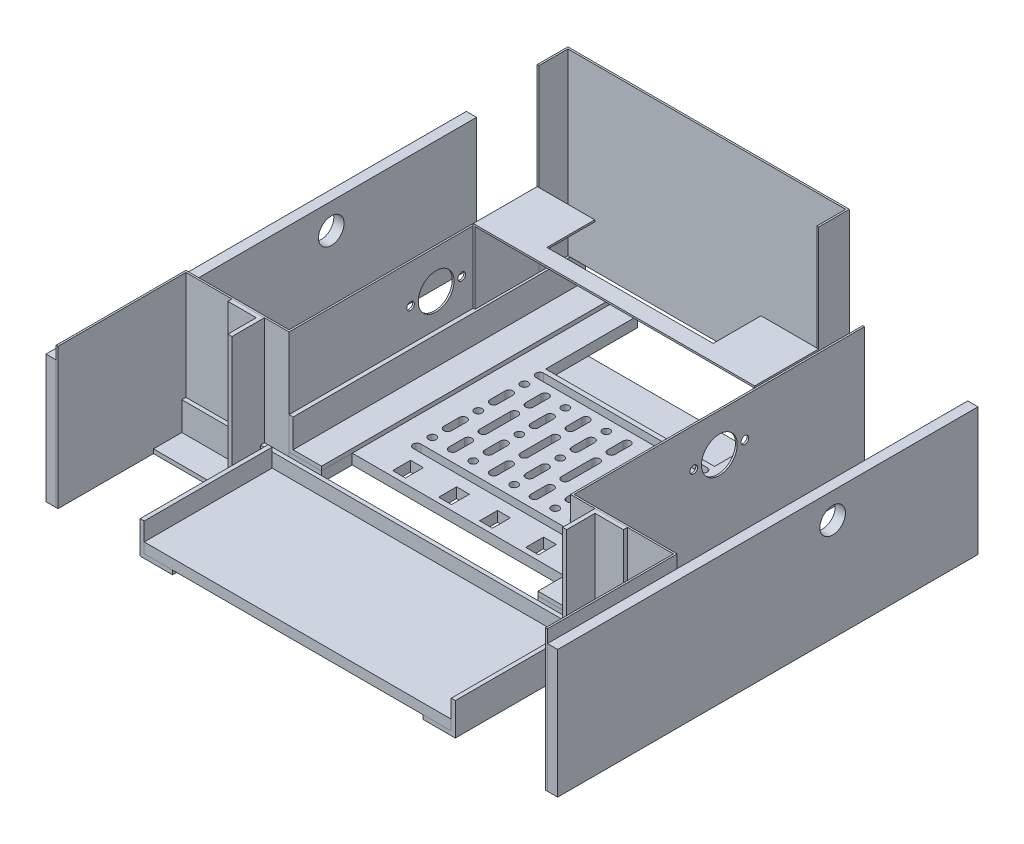
from build123d import *

# Parameters (mm, degrees)
PLATFORM_START                      = 18
SKETCH2_5_W                         = 120
SKETCH2_5_H                         = 50
PLATFORM_DEPTH                      = 4
STEEL_START                         = 10.8
STEEL_FRAME_RH_DEPTH                = 55
MDF_START                           = 10.8
SKETCH2_3_W                         = 4
SKETCH2_3_H                         = 164.3
MDF_WHEEL_COVER_RH_DEPTH            = 50
ALU_ANGLE_PLATFORM_REST_DEPTH       = 95.3
SHAFT_START                         = -55.7
DRIVE_AXLE_HOLES_R                  = 7
SHAFT_COUPLER_HOLES_DEPTH           = 111.4
BUSHING_START                       = -100
BUSHING_HOLES_OUTLINE_R             = 5
BUSHING_HOLES_DEPTH                 = 200
SKETCH7_W                           = 1.5
SKETCH7_H                           = 0.701
F_3_0MM_MOTOR_MOUNT_RH_AT_2_COUNT   = 2
F_3_0MM_MOTOR_MOUNT_RH_AT_2_PITCH   = 20
PLATFORM_START_2                    = -50
PLATFORM_ANGLE_RH_DEPTH             = 50
PLATFORM_START_3                    = 55
PLATFORM_ANGLE_RH_2_OUTLINE_R       = 1.5
PLATFORM_ANGLE_RH_2_DEPTH           = 0.7
MOTOR_START                         = -10.7
MOTOR_REST_CHASSIS_BRACING_LH_DEPTH = 114.3
CHASSIS_START                       = -125
SKETCH13_W                          = 110
SKETCH13_H                          = 4
CHASSIS_BASE_DEPTH                  = 114.3
SKETCH15_W                          = 84.6
SKETCH15_H                          = 12
SENSOR_CAVITY_DEPTH                 = 4
SKETCH14_W                          = 5
SKETCH14_H                          = 7
LINE_SENSOR_CAVITIES_DEPTH          = 4
SKETCH17_R                          = 1.5
WIRING_HOLES_DEPTH                  = 4
SKETCH19_W                          = 66
SKETCH19_H                          = 36
BATTERY_CAVITY_DEPTH                = 4
FLICKER_START                       = 23.5
FLICKER_MOUNT_RH_DEPTH              = 42.3
FLICKER_START_2                     = 12.4
FLICKER_MOUNT_RH_2_OUTLINE_W        = 1.6
FLICKER_MOUNT_RH_2_OUTLINE_H        = 11.1
FLICKER_MOUNT_RH_2_DEPTH            = 11.1
BATTERY_START                       = -105.7
BATTERY_SLOT_ANGLE_OUTLINE_W        = 110
BATTERY_SLOT_ANGLE_OUTLINE_H        = 1.6
BATTERY_SLOT_ANGLE_DEPTH            = 12.7
BATTERY_START_2                     = -94.6
BATTERY_SLOT_ANGLE_2_OUTLINE_W      = 110
BATTERY_SLOT_ANGLE_2_OUTLINE_H      = 11.1
BATTERY_SLOT_ANGLE_2_DEPTH          = 1.6
BATTERY_START_3                     = -55
BATTERY_HOLDER_OUTLINE_W            = 70
BATTERY_HOLDER_OUTLINE_H            = 0.7
BATTERY_HOLDER_DEPTH                = 110
BATTERY_HOLDER_2_OUTLINE_W          = 70
BATTERY_HOLDER_2_OUTLINE_H          = 11.3
BATTERY_HOLDER_2_DEPTH              = 0.7
BATTERY_START_4                     = 54.3
BATTERY_HOLDER_3_OUTLINE_W          = 70
BATTERY_HOLDER_3_OUTLINE_H          = 11.3
BATTERY_HOLDER_3_DEPTH              = 0.7
BOSS_EXTRUDE3_START                 = -107.7
BOSS_EXTRUDE3_OUTLINE_W             = 22.5
BOSS_EXTRUDE3_OUTLINE_H             = 0.7
BOSS_EXTRUDE3_DEPTH                 = 25
BOSS_EXTRUDE3_START_2               = -89
BOSS_EXTRUDE3_2_OUTLINE_W           = 65
BOSS_EXTRUDE3_2_OUTLINE_H           = 0.7
BOSS_EXTRUDE3_2_DEPTH               = 6.3
SKETCH24_W                          = 0.7
SKETCH24_H                          = 25
BOSS_EXTRUDE5_DEPTH                 = 28.7
BOSS_EXTRUDE5_2_DEPTH               = 28.7


# Read off the part's stored shape, not the designer's step: Bushing Holes, Platform Angle RH, Flicker Mount RH, Battery Slot Angle, Battery Holder, Boss-Extrude3
with BuildPart() as part:
    # Sketch2<5> → Platform (new body)
    with BuildSketch(Plane(origin=(0, 0, 0), x_dir=(1, 0, 0), z_dir=(0, 1, 0)).offset(PLATFORM_START)):
        with Locations((0, -15.9)):
            Rectangle(SKETCH2_5_W, SKETCH2_5_H)
    extrude(amount=-PLATFORM_DEPTH)


with BuildPart() as body_2:
    # Sketch2 → Steel Frame RH (new body)
    with BuildSketch(Plane(origin=(0, 0, 0), x_dir=(1, 0, 0), z_dir=(0, 1, 0)).offset(STEEL_START)):
        Polygon((-55, 125), (-55.7, 125), (-55.7, 11.4), (-96, 11.4), (-96, -39.3), (-95.3, -39.3), (-95.3, 10.7), (-55, 10.7), (-55, 55.2), (-55, 81.2), align=None)
    extrude(amount=STEEL_FRAME_RH_DEPTH)


with BuildPart() as body_3:
    # Steel Frame LH: mirrored copy
    add(body_2.part.mirror(Plane(origin=(0, 0, 0), x_dir=(0, 0, 1), z_dir=(1, 0, 0))))


with BuildPart() as body_4:
    # Sketch2<3> → MDF Wheel Cover RH (new body)
    with BuildSketch(Plane(origin=(0, 0, 0), x_dir=(1, 0, 0), z_dir=(0, 1, 0)).offset(MDF_START)):
        with Locations((-98, 42.85)):
            Rectangle(SKETCH2_3_W, SKETCH2_3_H)
    extrude(amount=MDF_WHEEL_COVER_RH_DEPTH)


with BuildPart() as body_5:
    # MDF Wheel Cover LH: mirrored copy
    add(body_4.part.mirror(Plane(origin=(0, 0, 0), x_dir=(0, 0, 1), z_dir=(1, 0, 0))))


with BuildPart() as body_6:
    # Sketch3 → Alu Angle Platform Rest (new, symmetric)
    with BuildSketch(Plane(origin=(0, 0, 0), x_dir=(0, 0, -1), z_dir=(1, 0, 0))):
        Polygon((9.1, 23.5), (9.1, 12.4), (-2, 12.4), (-2, 10.8), (10.7, 10.8), (10.7, 23.5), align=None)
    extrude(amount=ALU_ANGLE_PLATFORM_REST_DEPTH, both=True)


with BuildPart() as shaft_coupler_holes_tool:
    # Drive Axle Holes → Shaft Coupler Holes (new body)
    with BuildSketch(Plane(origin=(0, 0, 0), x_dir=(0, 0, -1), z_dir=(1, 0, 0)).offset(SHAFT_START)):
        with Locations(Location((68.2, 50.8, 0), (0, 0, 180))):
            Circle(DRIVE_AXLE_HOLES_R)
    extrude(amount=SHAFT_COUPLER_HOLES_DEPTH)


with BuildPart() as body_2_1:
    add(body_2.part)

    # Shaft Coupler Holes: cut by shaft_coupler_holes_tool
    add(shaft_coupler_holes_tool.part, mode=Mode.SUBTRACT)

    # Sketch7 → Ø3.0mm Motor Mount RH (revolve, cut)
    with BuildSketch(Plane(origin=(-55, 50.8, -78.2), x_dir=(0, 0, -1), z_dir=(0, 1, 0))):
        with Locations((0.75, 0.3505)):
            Rectangle(SKETCH7_W, SKETCH7_H)
    f_3_0mm_motor_mount_rh = revolve(axis=Axis((-48.65, 50.8, -78.2), (-1, 0, 0)), mode=Mode.SUBTRACT)

    # Ø3.0mm Motor Mount RH at 2: Ø3.0mm Motor Mount RH ×2
    with Locations(*[(0, 0, i * F_3_0MM_MOTOR_MOUNT_RH_AT_2_PITCH) for i in range(1, F_3_0MM_MOTOR_MOUNT_RH_AT_2_COUNT)]):
        add(f_3_0mm_motor_mount_rh, mode=Mode.SUBTRACT)


with BuildPart() as body_3_1:
    add(body_3.part)

    # Shaft Coupler Holes: cut by shaft_coupler_holes_tool
    add(shaft_coupler_holes_tool.part, mode=Mode.SUBTRACT)

    # Platform Angle RH 2 outline → Platform Angle RH 2 (cut)
    with BuildSketch(Plane.YZ.offset(PLATFORM_START_3)):
        with Locations((50.8, -78.2)):
            Circle(PLATFORM_ANGLE_RH_2_OUTLINE_R)
        with Locations((50.8, -58.2)):
            Circle(PLATFORM_ANGLE_RH_2_OUTLINE_R)
    extrude(amount=PLATFORM_ANGLE_RH_2_DEPTH, mode=Mode.SUBTRACT)


with BuildPart() as bushing_holes_tool:
    # Bushing Holes outline → Bushing Holes (new body)
    with BuildSketch(Plane.YZ.offset(BUSHING_START)):
        with Locations((50.8, -68.2)):
            Circle(BUSHING_HOLES_OUTLINE_R)
    extrude(amount=BUSHING_HOLES_DEPTH)


with BuildPart() as body_4_1:
    add(body_4.part)

    # Bushing Holes: cut by bushing_holes_tool
    add(bushing_holes_tool.part, mode=Mode.SUBTRACT)


with BuildPart() as body_5_1:
    add(body_5.part)

    # Bushing Holes: cut by bushing_holes_tool
    add(bushing_holes_tool.part, mode=Mode.SUBTRACT)


with BuildPart() as body_7:
    # Platform Angle RH outline → Platform Angle RH (new body)
    with BuildSketch(Plane.XY.offset(40.9).offset(PLATFORM_START_2)):
        Polygon((-48.9, 12.4), (-48.9, 14), (-60, 14), (-60, 25.1), (-61.6, 25.1), (-61.6, 12.4), align=None)
    extrude(amount=PLATFORM_ANGLE_RH_DEPTH)


with BuildPart() as body_8:
    # Platform Angle LH: mirrored copy
    add(body_7.part.mirror(Plane(origin=(0, 0, 0), x_dir=(0, 0, 1), z_dir=(1, 0, 0))))


with BuildPart() as body_9:
    # Sketch12 → Motor Rest + Chassis Bracing LH (new body)
    with BuildSketch(Plane.XY.offset(MOTOR_START)):
        Polygon((53.4, 26.7), (53.4, 37.8), (55, 37.8), (55, 25.1), (42.3, 25.1), (42.3, 26.7), align=None)
    extrude(amount=-MOTOR_REST_CHASSIS_BRACING_LH_DEPTH)


with BuildPart() as body_10:
    # Motor Rest + Chassis Bracing RH: mirrored copy
    add(body_9.part.mirror(Plane(origin=(0, 0, 0), x_dir=(0, 0, 1), z_dir=(1, 0, 0))))


with BuildPart() as body_11:
    # Sketch13 → Chassis Base (new body)
    with BuildSketch(Plane.XY.offset(CHASSIS_START)):
        with Locations((0, 23.1)):
            Rectangle(SKETCH13_W, SKETCH13_H)
    extrude(amount=CHASSIS_BASE_DEPTH)

    # Sketch15 → Sensor Cavity (cut)
    with BuildSketch(Plane.XZ.offset(-21.1)):
        with Locations((0, -16.7)):
            Rectangle(SKETCH15_W, SKETCH15_H)
    extrude(amount=-SENSOR_CAVITY_DEPTH, mode=Mode.SUBTRACT)

    # Sketch14 → Line Sensor Cavities (cut)
    with BuildSketch(Plane.XZ.offset(-21.1)):
        with Locations((-8, -28.2)):
            Rectangle(SKETCH14_W, SKETCH14_H)
        with Locations((-26, -28.2)):
            Rectangle(SKETCH14_W, SKETCH14_H)
        with Locations((8, -28.2)):
            Rectangle(SKETCH14_W, SKETCH14_H)
        with Locations((26, -28.2)):
            Rectangle(SKETCH14_W, SKETCH14_H)
    extrude(amount=-LINE_SENSOR_CAVITIES_DEPTH, mode=Mode.SUBTRACT)

    # Sketch17 → Wiring Holes (cut)
    with BuildSketch(Plane.XZ.offset(-21.1)):
        with Locations(Location((-32, -43.7, 0), (0, 0, 270))):
            Circle(SKETCH17_R)
        with Locations(Location((-32, -61.7, 0), (0, 0, 270))):
            Circle(SKETCH17_R)
        with Locations(Location((-32, -79.7, 0), (0, 0, 270))):
            Circle(SKETCH17_R)
        with Locations(Location((32, -79.7, 0), (0, 0, 180))):
            Circle(SKETCH17_R)
        with Locations(Location((32, -61.7, 0), (0, 0, 180))):
            Circle(SKETCH17_R)
        with Locations(Location((32, -43.7, 0), (0, 0, 180))):
            Circle(SKETCH17_R)
        with Locations(Location((-16, -43.7, 0), (0, 0, 270))):
            Circle(SKETCH17_R)
        with Locations(Location((-16, -61.7, 0), (0, 0, 270))):
            Circle(SKETCH17_R)
        with Locations(Location((-16, -79.7, 0), (0, 0, 270))):
            Circle(SKETCH17_R)
        with Locations(Location((0, -43.7, 0), (0, 0, 270))):
            Circle(SKETCH17_R)
        with Locations(Location((0, -61.7, 0), (0, 0, 270))):
            Circle(SKETCH17_R)
        with Locations(Location((0, -79.7, 0), (0, 0, 270))):
            Circle(SKETCH17_R)
        with Locations(Location((16, -43.7, 0), (0, 0, 270))):
            Circle(SKETCH17_R)
        with Locations(Location((16, -61.7, 0), (0, 0, 270))):
            Circle(SKETCH17_R)
        with Locations(Location((16, -79.7, 0), (0, 0, 270))):
            Circle(SKETCH17_R)
        with BuildLine():
            Line((-32, -36.2), (32, -36.2))
            ThreePointArc((32, -36.2), (33.5, -37.7), (32, -39.2))
            Line((32, -39.2), (-32, -39.2))
            ThreePointArc((-32, -39.2), (-33.5, -37.7), (-32, -36.2))
        make_face()
        with BuildLine():
            Line((-32, -84.2), (32, -84.2))
            ThreePointArc((32, -84.2), (33.5, -85.7), (32, -87.2))
            Line((32, -87.2), (-32, -87.2))
            ThreePointArc((-32, -87.2), (-33.5, -85.7), (-32, -84.2))
        make_face()
        with BuildLine():
            Line((-30.5, -49.7), (-30.5, -55.7))
            ThreePointArc((-30.5, -55.7), (-32, -57.2), (-33.5, -55.7))
            Line((-33.5, -55.7), (-33.5, -49.7))
            ThreePointArc((-33.5, -49.7), (-32, -48.2), (-30.5, -49.7))
        make_face()
        with BuildLine():
            Line((-30.5, -67.7), (-30.5, -73.7))
            ThreePointArc((-30.5, -73.7), (-32, -75.2), (-33.5, -73.7))
            Line((-33.5, -73.7), (-33.5, -67.7))
            ThreePointArc((-33.5, -67.7), (-32, -66.2), (-30.5, -67.7))
        make_face()
        with BuildLine():
            Line((30.5, -49.7), (30.5, -55.7))
            ThreePointArc((30.5, -55.7), (32, -57.2), (33.5, -55.7))
            Line((33.5, -55.7), (33.5, -49.7))
            ThreePointArc((33.5, -49.7), (32, -48.2), (30.5, -49.7))
        make_face()
        with BuildLine():
            Line((30.5, -67.7), (30.5, -73.7))
            ThreePointArc((30.5, -73.7), (32, -75.2), (33.5, -73.7))
            Line((33.5, -73.7), (33.5, -67.7))
            ThreePointArc((33.5, -67.7), (32, -66.2), (30.5, -67.7))
        make_face()
        with BuildLine():
            Line((-22.5, -43.7), (-22.5, -49.7))
            ThreePointArc((-22.5, -49.7), (-24, -51.2), (-25.5, -49.7))
            Line((-25.5, -49.7), (-25.5, -43.7))
            ThreePointArc((-25.5, -43.7), (-24, -42.2), (-22.5, -43.7))
        make_face()
        with BuildLine():
            Line((-22.5, -55.7), (-22.5, -67.7))
            ThreePointArc((-22.5, -67.7), (-24, -69.2), (-25.5, -67.7))
            Line((-25.5, -67.7), (-25.5, -55.7))
            ThreePointArc((-25.5, -55.7), (-24, -54.2), (-22.5, -55.7))
        make_face()
        with BuildLine():
            Line((-25.5, -79.7), (-25.5, -73.7))
            ThreePointArc((-25.5, -73.7), (-24, -72.2), (-22.5, -73.7))
            Line((-22.5, -73.7), (-22.5, -79.7))
            ThreePointArc((-22.5, -79.7), (-24, -81.2), (-25.5, -79.7))
        make_face()
        with BuildLine():
            Line((-14.5, -49.7), (-14.5, -55.7))
            ThreePointArc((-14.5, -55.7), (-16, -57.2), (-17.5, -55.7))
            Line((-17.5, -55.7), (-17.5, -49.7))
            ThreePointArc((-17.5, -49.7), (-16, -48.2), (-14.5, -49.7))
        make_face()
        with BuildLine():
            Line((-14.5, -67.7), (-14.5, -73.7))
            ThreePointArc((-14.5, -73.7), (-16, -75.2), (-17.5, -73.7))
            Line((-17.5, -73.7), (-17.5, -67.7))
            ThreePointArc((-17.5, -67.7), (-16, -66.2), (-14.5, -67.7))
        make_face()
        with BuildLine():
            Line((-6.5, -43.7), (-6.5, -49.7))
            ThreePointArc((-6.5, -49.7), (-8, -51.2), (-9.5, -49.7))
            Line((-9.5, -49.7), (-9.5, -43.7))
            ThreePointArc((-9.5, -43.7), (-8, -42.2), (-6.5, -43.7))
        make_face()
        with BuildLine():
            Line((-6.5, -55.7), (-6.5, -67.7))
            ThreePointArc((-6.5, -67.7), (-8, -69.2), (-9.5, -67.7))
            Line((-9.5, -67.7), (-9.5, -55.7))
            ThreePointArc((-9.5, -55.7), (-8, -54.2), (-6.5, -55.7))
        make_face()
        with BuildLine():
            Line((-9.5, -79.7), (-9.5, -73.7))
            ThreePointArc((-9.5, -73.7), (-8, -72.2), (-6.5, -73.7))
            Line((-6.5, -73.7), (-6.5, -79.7))
            ThreePointArc((-6.5, -79.7), (-8, -81.2), (-9.5, -79.7))
        make_face()
        with BuildLine():
            Line((1.5, -49.7), (1.5, -55.7))
            ThreePointArc((1.5, -55.7), (0, -57.2), (-1.5, -55.7))
            Line((-1.5, -55.7), (-1.5, -49.7))
            ThreePointArc((-1.5, -49.7), (0, -48.2), (1.5, -49.7))
        make_face()
        with BuildLine():
            Line((1.5, -67.7), (1.5, -73.7))
            ThreePointArc((1.5, -73.7), (0, -75.2), (-1.5, -73.7))
            Line((-1.5, -73.7), (-1.5, -67.7))
            ThreePointArc((-1.5, -67.7), (0, -66.2), (1.5, -67.7))
        make_face()
        with BuildLine():
            Line((9.5, -43.7), (9.5, -49.7))
            ThreePointArc((9.5, -49.7), (8, -51.2), (6.5, -49.7))
            Line((6.5, -49.7), (6.5, -43.7))
            ThreePointArc((6.5, -43.7), (8, -42.2), (9.5, -43.7))
        make_face()
        with BuildLine():
            Line((9.5, -55.7), (9.5, -67.7))
            ThreePointArc((9.5, -67.7), (8, -69.2), (6.5, -67.7))
            Line((6.5, -67.7), (6.5, -55.7))
            ThreePointArc((6.5, -55.7), (8, -54.2), (9.5, -55.7))
        make_face()
        with BuildLine():
            Line((6.5, -79.7), (6.5, -73.7))
            ThreePointArc((6.5, -73.7), (8, -72.2), (9.5, -73.7))
            Line((9.5, -73.7), (9.5, -79.7))
            ThreePointArc((9.5, -79.7), (8, -81.2), (6.5, -79.7))
        make_face()
        with BuildLine():
            Line((17.5, -49.7), (17.5, -55.7))
            ThreePointArc((17.5, -55.7), (16, -57.2), (14.5, -55.7))
            Line((14.5, -55.7), (14.5, -49.7))
            ThreePointArc((14.5, -49.7), (16, -48.2), (17.5, -49.7))
        make_face()
        with BuildLine():
            Line((17.5, -67.7), (17.5, -73.7))
            ThreePointArc((17.5, -73.7), (16, -75.2), (14.5, -73.7))
            Line((14.5, -73.7), (14.5, -67.7))
            ThreePointArc((14.5, -67.7), (16, -66.2), (17.5, -67.7))
        make_face()
        with BuildLine():
            Line((25.5, -43.7), (25.5, -49.7))
            ThreePointArc((25.5, -49.7), (24, -51.2), (22.5, -49.7))
            Line((22.5, -49.7), (22.5, -43.7))
            ThreePointArc((22.5, -43.7), (24, -42.2), (25.5, -43.7))
        make_face()
        with BuildLine():
            Line((25.5, -55.7), (25.5, -67.7))
            ThreePointArc((25.5, -67.7), (24, -69.2), (22.5, -67.7))
            Line((22.5, -67.7), (22.5, -55.7))
            ThreePointArc((22.5, -55.7), (24, -54.2), (25.5, -55.7))
        make_face()
        with BuildLine():
            Line((22.5, -79.7), (22.5, -73.7))
            ThreePointArc((22.5, -73.7), (24, -72.2), (25.5, -73.7))
            Line((25.5, -73.7), (25.5, -79.7))
            ThreePointArc((25.5, -79.7), (24, -81.2), (22.5, -79.7))
        make_face()
    extrude(amount=-WIRING_HOLES_DEPTH, mode=Mode.SUBTRACT)

    # Sketch19 → Battery Cavity (cut)
    with BuildSketch(Plane(origin=(0, 25.1, 0), x_dir=(1, 0, 0), z_dir=(0, 1, 0))):
        with Locations((0, 107)):
            Rectangle(SKETCH19_W, SKETCH19_H)
    extrude(amount=-BATTERY_CAVITY_DEPTH, mode=Mode.SUBTRACT)


with BuildPart() as body_12:
    # Flicker Mount RH outline → Flicker Mount RH (new body)
    with BuildSketch(Plane(origin=(0, 0, 0), x_dir=(1, 0, 0), z_dir=(0, 1, 0)).offset(FLICKER_START)):
        Polygon((-64.6, -2), (-64.6, 10.7), (-77.3, 10.7), (-77.3, 9.1), (-66.2, 9.1), (-66.2, -2), align=None)
    extrude(amount=FLICKER_MOUNT_RH_DEPTH)

    # Flicker Mount RH 2 outline → Flicker Mount RH 2 (add)
    with BuildSketch(Plane(origin=(0, 0, 0), x_dir=(1, 0, 0), z_dir=(0, 1, 0)).offset(FLICKER_START_2)):
        with Locations((-65.4, 3.55)):
            Rectangle(FLICKER_MOUNT_RH_2_OUTLINE_W, FLICKER_MOUNT_RH_2_OUTLINE_H)
    extrude(amount=FLICKER_MOUNT_RH_2_DEPTH)


with BuildPart() as body_13:
    # Flicker Mount LH: mirrored copy
    add(body_12.part.mirror(Plane(origin=(0, 0, 0), x_dir=(0, 0, 1), z_dir=(1, 0, 0))))


with BuildPart() as body_14:
    # Battery Slot Angle outline → Battery Slot Angle (new body)
    with BuildSketch(Plane.XY.offset(BATTERY_START)):
        with Locations((0, 20.3)):
            Rectangle(BATTERY_SLOT_ANGLE_OUTLINE_W, BATTERY_SLOT_ANGLE_OUTLINE_H)
    extrude(amount=BATTERY_SLOT_ANGLE_DEPTH)

    # Battery Slot Angle 2 outline → Battery Slot Angle 2 (add)
    with BuildSketch(Plane.XY.offset(BATTERY_START_2)):
        with Locations((0, 13.95)):
            Rectangle(BATTERY_SLOT_ANGLE_2_OUTLINE_W, BATTERY_SLOT_ANGLE_2_OUTLINE_H)
    extrude(amount=BATTERY_SLOT_ANGLE_2_DEPTH)


with BuildPart() as body_15:
    # Battery Holder outline → Battery Holder (new body)
    with BuildSketch(Plane.YZ.offset(BATTERY_START_3)):
        with Locations((72.8, -119.35)):
            Rectangle(BATTERY_HOLDER_OUTLINE_W, BATTERY_HOLDER_OUTLINE_H)
    extrude(amount=BATTERY_HOLDER_DEPTH)

    # Battery Holder 2 outline → Battery Holder 2 (add)
    with BuildSketch(Plane.YZ.offset(BATTERY_START_3)):
        with Locations((72.8, -113.35)):
            Rectangle(BATTERY_HOLDER_2_OUTLINE_W, BATTERY_HOLDER_2_OUTLINE_H)
    extrude(amount=BATTERY_HOLDER_2_DEPTH)

    # Battery Holder 3 outline → Battery Holder 3 (add)
    with BuildSketch(Plane.YZ.offset(BATTERY_START_4)):
        with Locations((72.8, -113.35)):
            Rectangle(BATTERY_HOLDER_3_OUTLINE_W, BATTERY_HOLDER_3_OUTLINE_H)
    extrude(amount=BATTERY_HOLDER_3_DEPTH)


with BuildPart() as body_16:
    # Boss-Extrude3 outline → Boss-Extrude3 (new body)
    with BuildSketch(Plane.XY.offset(BOSS_EXTRUDE3_START)):
        with Locations((43.75, 66.15)):
            Rectangle(BOSS_EXTRUDE3_OUTLINE_W, BOSS_EXTRUDE3_OUTLINE_H)
        with Locations((-43.75, 66.15)):
            Rectangle(BOSS_EXTRUDE3_OUTLINE_W, BOSS_EXTRUDE3_OUTLINE_H)
    extrude(amount=BOSS_EXTRUDE3_DEPTH)

    # Boss-Extrude3 2 outline → Boss-Extrude3 2 (add)
    with BuildSketch(Plane.XY.offset(BOSS_EXTRUDE3_START_2)):
        with Locations((0, 66.15)):
            Rectangle(BOSS_EXTRUDE3_2_OUTLINE_W, BOSS_EXTRUDE3_2_OUTLINE_H)
    extrude(amount=BOSS_EXTRUDE3_2_DEPTH)


with BuildPart() as body_17:
    # Sketch24 → Boss-Extrude5 (new body)
    with BuildSketch(Plane(origin=(0, 66.5, 0), x_dir=(1, 0, 0), z_dir=(0, 1, 0))):
        with Locations((-54.65, 95.2)):
            Rectangle(SKETCH24_W, SKETCH24_H)
    extrude(amount=-BOSS_EXTRUDE5_DEPTH)


with BuildPart() as body_18:
    # Sketch24 → Boss-Extrude5 2 (new body)
    with BuildSketch(Plane(origin=(0, 66.5, 0), x_dir=(1, 0, 0), z_dir=(0, 1, 0))):
        with Locations((54.65, 95.2)):
            Rectangle(SKETCH24_W, SKETCH24_H)
    extrude(amount=-BOSS_EXTRUDE5_2_DEPTH)


with BuildPart() as body_16_1:
    add(body_16.part)

    # Combine1: union body 17, body 18
    add(body_17.part)
    add(body_18.part)


solid = Compound([part.part, body_6.part, body_2_1.part, body_3_1.part, body_4_1.part, body_5_1.part, body_7.part, body_8.part, body_9.part, body_10.part, body_11.part, body_12.part, body_13.part, body_14.part, body_15.part, body_16_1.part])
